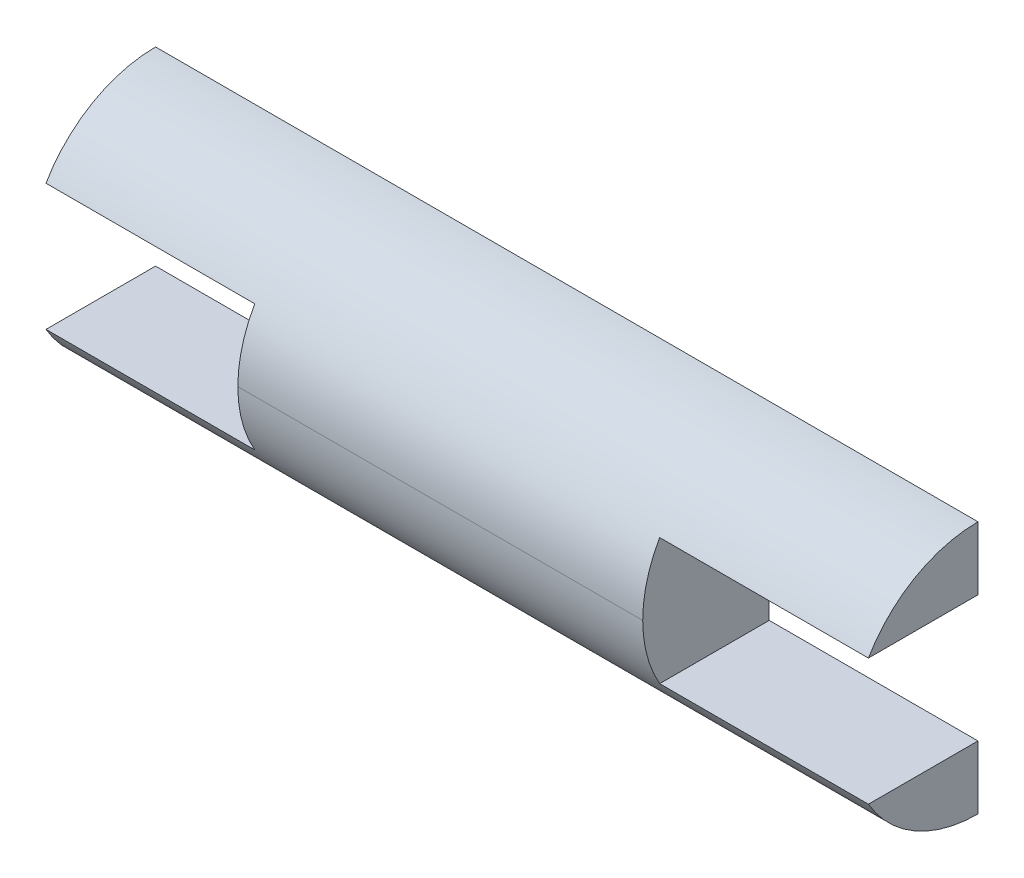
from build123d import *

# Parameters (mm, degrees)
BOSS_EXTRUDE1_DEPTH = 2
FILLET1_R           = 2


with BuildPart() as part:
    # Sketch1 → Boss-Extrude1 (new body)
    with BuildSketch(Plane.XY):
        Polygon((0, 0), (13, 0), (13, 1), (9.7, 1), (9.7, 3), (13, 3), (13, 4), (0, 4), (0, 3), (3.3, 3), (3.3, 1), (0, 1), align=None)
    extrude(amount=BOSS_EXTRUDE1_DEPTH)

    # Fillet1
    fillet1_edges = [part.edges().sort_by_distance(p)[0] for p in [
        (6.5, 0, 2),
        (6.5, 4, 2),
    ]]
    fillet(fillet1_edges, radius=FILLET1_R - 0.0001)  # a hair under: the kernel refuses the full size


solid = part.part
